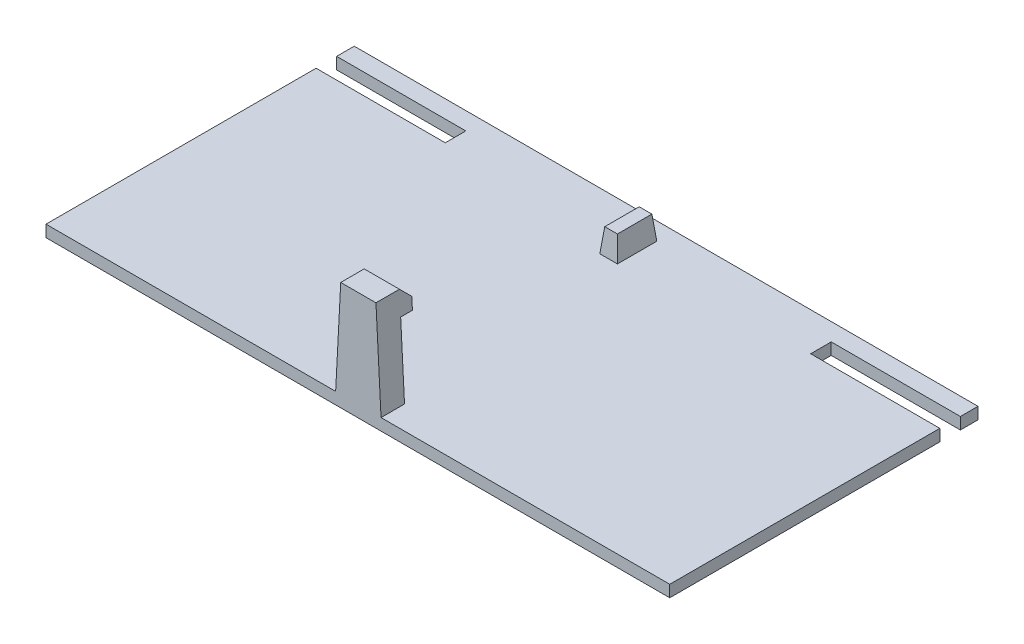
from build123d import *

# Parameters (mm, degrees)
SKETCH1_W             = 53.116817528
SKETCH1_H             = 26.25
BOSS_EXTRUDE1_DEPTH   = 1
SKETCH2_W             = 1.5
SKETCH2_H             = 3.354457941
BOSS_EXTRUDE2_DEPTH   = 2
BOSS_EXTRUDE2_TAPER   = 6
SNAP_START            = 10.433767634
SNAP_HOOK3_DEPTH      = 2
SNAP_HOOK3_2_DEPTH    = 2
SKETCH5_W             = 0.807692308
SKETCH5_H             = 3.288461538
SKETCH5_H_2           = 4.615384615
LETTERING_DEPTH       = 0.25
SOLAR_ARM_HOLES_REACH = 216.666
SKETCH6_W             = 11
SKETCH6_H             = 1.75


with BuildPart() as part:
    # Sketch1 → Boss-Extrude1 (new body)
    with BuildSketch(Plane(origin=(0, 0, 0), x_dir=(1, 0, 0), z_dir=(0, 1, 0))):
        with Locations((187.462852022, 0.691232366)):
            Rectangle(SKETCH1_W, SKETCH1_H)
    extrude(amount=BOSS_EXTRUDE1_DEPTH)

    # Sketch2 → Boss-Extrude2 (add)
    with BuildSketch(Plane(origin=(0, 1, 0), x_dir=(1, 0, 0), z_dir=(0, 1, 0))):
        with Locations((187.420846341, 10.639003396)):
            Rectangle(SKETCH2_W, SKETCH2_H)
    extrude(amount=BOSS_EXTRUDE2_DEPTH, taper=BOSS_EXTRUDE2_TAPER)



with BuildPart() as body_2:
    # Snap Hook3: read off the stored shape, not the designer's step
    # Snap Hook3 outline → Snap Hook3 (new body)
    with BuildSketch(Plane.XY.offset(SNAP_START)):
        Polygon((185.897673338, 7.25), (189.107304455, 7.25), (189.002488896, 9.25), (186.002488896, 9.25), align=None)
    extrude(amount=SNAP_HOOK3_DEPTH)


with BuildPart() as part_1:
    add(part.part)

    add(body_2.part)  # Snap Hook3 2 merges body 2
    # Snap Hook3 2 outline → Snap Hook3 2 (add)
    with BuildSketch(Plane.XY.offset(SNAP_START)):
        Polygon((185.570124717, 1), (189.434853075, 1), (189.107304455, 7.25), (185.897673338, 7.25), align=None)
    extrude(amount=SNAP_HOOK3_2_DEPTH)

    # Snap Hook3 3: loft between two sections, ruled curve by curve
    snap_hook3_3_from = [
        Edge.make_line((186.002488896, 9.25, 10.433767634), (189.002488896, 9.25, 10.433767634)),
        Edge.make_line((189.107304455, 7.25, 10.433767634), (185.897673338, 7.25, 10.433767634)),
        Edge.make_line((185.897673338, 7.25, 10.433767634), (186.002488896, 9.25, 10.433767634)),
        Edge.make_line((189.107304455, 7.25, 10.433767634), (189.002488896, 9.25, 10.433767634)),
    ]
    snap_hook3_3_to = [
        Edge.make_line((185.950081117, 8.25, 9.433767634), (189.054896676, 8.25, 9.433767634)),
        Edge.make_line((189.107304455, 7.25, 9.433767634), (185.897673338, 7.25, 9.433767634)),
        Edge.make_line((185.897673338, 7.25, 9.433767634), (185.950081117, 8.25, 9.433767634)),
        Edge.make_line((189.107304455, 7.25, 9.433767634), (189.054896676, 8.25, 9.433767634)),
    ]
    snap_hook3_3 = Solid(Shell([*[Face.make_surface_from_curves(snap_hook3_3_from[k], snap_hook3_3_to[k]) for k in range(4)], Face(Wire(snap_hook3_3_from)), Face(Wire(snap_hook3_3_to))]))
    add(snap_hook3_3)

    # Sketch5 → Lettering (cut)
    # profile 1 of 14: a face of its own
    with BuildSketch(Plane.XZ):
        with BuildLine():
            Line((168.666698176, 3.207505615), (168.06273183, 2.65492148))
            add(Edge.make_bspline(
                [(168.06273183, 2.65492148), (168.036860501, 2.691415678), (167.987191158, 2.76147945), (167.906682334, 2.855296492), (167.826537048, 2.935329411), (167.746012804, 3.001243865), (167.664395865, 3.052639376), (167.581827906, 3.089027966), (167.498777028, 3.112160538), (167.442979658, 3.1150411), (167.415496253, 3.116459942)],
                knots=[0, 0, 0, 0, 1.299362458, 2.494594718, 3.587462134, 4.587049575, 5.512617175, 6.380583204, 7.202344345, 8, 8, 8, 8], degree=3))
            add(Edge.make_bspline(
                [(167.415496253, 3.116459942), (167.389860521, 3.115560898), (167.340364658, 3.113825082), (167.269804633, 3.096571196), (167.207160438, 3.066793523), (167.152493211, 3.02785671), (167.109188702, 2.980946878), (167.07461341, 2.931750526), (167.055144615, 2.877448879), (167.052582138, 2.840152317), (167.05131356, 2.821688307)],
                knots=[0, 0, 0, 0, 1.185010067, 2.2879431, 3.333075148, 4.379039566, 5.372662701, 6.27520591, 7.14612461, 8, 8, 8, 8], degree=3))
            add(Edge.make_bspline(
                [(167.05131356, 2.821688307), (167.052108514, 2.802958037), (167.053709439, 2.765237877), (167.069172203, 2.709954284), (167.092479003, 2.655935779), (167.114749602, 2.623052144), (167.126133272, 2.606243595)],
                knots=[0, 0, 0, 0, 0.967525499, 1.948461899, 2.951351359, 4, 4, 4, 4], degree=3))
            add(Edge.make_bspline(
                [(167.126133272, 2.606243595), (167.136482259, 2.593178486), (167.160304262, 2.56310433), (167.205727943, 2.515471555), (167.262770545, 2.457117235), (167.33362719, 2.390048007), (167.415356422, 2.311851796), (167.511746498, 2.225602527), (167.620022889, 2.128629159), (167.69698324, 2.061100417), (167.737311156, 2.025714749)],
                knots=[0, 0, 0, 0, 0.473873513, 1.090794244, 1.870441696, 2.795289791, 3.865433203, 5.087734844, 6.473946851, 8, 8, 8, 8], degree=3))
            add(Edge.make_bspline(
                [(167.737311156, 2.025714749), (167.775164707, 1.99295441), (167.847002882, 1.930782094), (167.949214339, 1.842538473), (168.039041186, 1.763147838), (168.117791996, 1.693801675), (168.184272984, 1.633772381), (168.238763635, 1.582773019), (168.28192946, 1.541796451), (168.306466705, 1.517046579), (168.31693856, 1.50648398)],
                knots=[0, 0, 0, 0, 1.543621617, 2.929473131, 4.163658386, 5.240097082, 6.164993805, 6.925417477, 7.541396219, 8, 8, 8, 8], degree=3))
            add(Edge.make_bspline(
                [(168.31693856, 1.50648398), (168.356666597, 1.463489735), (168.433037837, 1.380839698), (168.532293525, 1.252758133), (168.613984168, 1.127724409), (168.677181597, 1.003385815), (168.724910838, 0.87794839), (168.758560585, 0.74833579), (168.778713643, 0.613193644), (168.780951103, 0.520975627), (168.782082791, 0.474332538)],
                knots=[0, 0, 0, 0, 1.206664779, 2.319633467, 3.337109185, 4.282041471, 5.190008762, 6.099243693, 7.03861361, 8, 8, 8, 8], degree=3))
            add(Edge.make_bspline(
                [(168.782082791, 0.474332538), (168.781277284, 0.428884567), (168.77969685, 0.339713958), (168.760339563, 0.209226053), (168.732737208, 0.084343466), (168.690059125, -0.033574907), (168.63804333, -0.146464657), (168.572834018, -0.252567322), (168.496254623, -0.352956705), (168.408482878, -0.445838223), (168.311396905, -0.530121762), (168.207262973, -0.605152959), (168.095062807, -0.667100769), (167.975755027, -0.718110373), (167.849403497, -0.757398651), (167.716158739, -0.786436351), (167.575816946, -0.80386432), (167.479849205, -0.805686207), (167.430820772, -0.806616982)],
                knots=[0, 0, 0, 0, 1.043214005, 2.046824704, 3.02475056, 3.976699089, 4.921714032, 5.875962561, 6.831408892, 7.817874052, 8.806269674, 9.781291748, 10.760897367, 11.74438705, 12.757449933, 13.795994037, 14.874007457, 16, 16, 16, 16], degree=3))
            add(Edge.make_bspline(
                [(167.430820772, -0.806616982), (167.392333869, -0.805934198), (167.316107729, -0.804581896), (167.203761923, -0.793541471), (167.095279347, -0.775723401), (166.990782197, -0.750184784), (166.889799696, -0.717823892), (166.792327695, -0.678296302), (166.699039077, -0.630989352), (166.609227976, -0.576875859), (166.523330984, -0.514042967), (166.440261968, -0.443775272), (166.360846047, -0.364992026), (166.284701805, -0.277879549), (166.212316431, -0.182191158), (166.141320495, -0.079259492), (166.074869268, 0.032825721), (166.033819389, 0.111454405), (166.012852022, 0.151616192)],
                knots=[0, 0, 0, 0, 1.016823716, 2.013894106, 2.979844003, 3.91962641, 4.853723003, 5.779685073, 6.695824784, 7.614987388, 8.547259901, 9.504950863, 10.487499108, 11.500346958, 12.559593716, 13.656357062, 14.802919212, 16, 16, 16, 16], degree=3))
            Line((166.012852022, 0.151616192), (166.72318856, 0.577998403))
            add(Edge.make_bspline(
                [(166.72318856, 0.577998403), (166.749415603, 0.532409528), (166.799695084, 0.445011759), (166.884898366, 0.327581779), (166.972184778, 0.227022439), (167.063572305, 0.145111132), (167.157949708, 0.080752599), (167.255772852, 0.034757527), (167.357110466, 0.006286629), (167.426137044, 0.002809675), (167.460568368, 0.001075326)],
                knots=[0, 0, 0, 0, 1.283663364, 2.460892379, 3.537111102, 4.529833553, 5.449777664, 6.316464042, 7.160231139, 8, 8, 8, 8], degree=3))
            add(Edge.make_bspline(
                [(167.460568368, 0.001075326), (167.495589953, 0.002491689), (167.56353693, 0.005239639), (167.660522544, 0.030621629), (167.749442627, 0.070473214), (167.82630449, 0.12733593), (167.89138627, 0.192964147), (167.939420359, 0.26597854), (167.969595698, 0.34497835), (167.972785963, 0.399856815), (167.974390483, 0.427457538)],
                knots=[0, 0, 0, 0, 1.13588714, 2.203786484, 3.234766741, 4.283437687, 5.291419208, 6.222934724, 7.106237994, 8, 8, 8, 8], degree=3))
            add(Edge.make_bspline(
                [(167.974390483, 0.427457538), (167.972908774, 0.453135519), (167.969898825, 0.50529788), (167.947728461, 0.582854923), (167.913069421, 0.660376694), (167.872065333, 0.723962149), (167.830338539, 0.777200526), (167.790438312, 0.823329172), (167.74185039, 0.87429325), (167.684697972, 0.930156868), (167.619736189, 0.99141181), (167.54691032, 1.058052076), (167.465386431, 1.129490645), (167.407765185, 1.178153893), (167.377635676, 1.203599365)],
                knots=[0, 0, 0, 0, 0.916159276, 1.861089862, 2.860218735, 3.940849679, 4.552606315, 5.27541173, 6.11797699, 7.06649574, 8.129236253, 9.306560635, 10.591630461, 12, 12, 12, 12], degree=3))
            add(Edge.make_bspline(
                [(167.377635676, 1.203599365), (167.320358279, 1.252061535), (167.210425618, 1.345075108), (167.05507682, 1.482453227), (166.915093644, 1.610845667), (166.791685134, 1.731839639), (166.683278875, 1.843200666), (166.590609041, 1.945833263), (166.514693653, 2.040529101), (166.434809076, 2.152689985), (166.358902756, 2.289365728), (166.293298155, 2.453802491), (166.250736659, 2.61821839), (166.245968236, 2.728598169), (166.243621253, 2.782926288)],
                knots=[0, 0, 0, 0, 1.345494975, 2.582412109, 3.71882943, 4.751509156, 5.681369928, 6.505683931, 7.230279997, 7.856715994, 8.973648664, 10.023341002, 11.027102913, 12, 12, 12, 12], degree=3))
            add(Edge.make_bspline(
                [(166.243621253, 2.782926288), (166.24459736, 2.821452874), (166.246520396, 2.897354386), (166.263674174, 3.008956502), (166.289311149, 3.116643166), (166.326543396, 3.220021489), (166.374866358, 3.318961985), (166.433552717, 3.413949009), (166.503513764, 3.504108324), (166.582355139, 3.589380158), (166.66921815, 3.667308911), (166.762042315, 3.736088844), (166.860302243, 3.794181375), (166.963396828, 3.842373348), (167.071964904, 3.879261242), (167.185206656, 3.90540922), (167.303284509, 3.920961204), (167.383598515, 3.923075315), (167.424510676, 3.924152249)],
                knots=[0, 0, 0, 0, 1.010766082, 1.991317756, 2.957454644, 3.913069143, 4.869106762, 5.843196583, 6.838735724, 7.860187025, 8.887984031, 9.89767229, 10.887916223, 11.879572884, 12.879850636, 13.892031539, 14.926195476, 16, 16, 16, 16], degree=3))
            add(Edge.make_bspline(
                [(167.424510676, 3.924152249), (167.47753081, 3.92221266), (167.583152558, 3.918348791), (167.739317357, 3.888134602), (167.891852604, 3.840619606), (168.014768365, 3.783297992), (168.112570141, 3.727770517), (168.187526067, 3.676647812), (168.263797756, 3.618084007), (168.342000292, 3.55189455), (168.420680551, 3.476832346), (168.50207579, 3.394684309), (168.585076897, 3.304740489), (168.639014457, 3.240485041), (168.666698176, 3.207505615)],
                knots=[0, 0, 0, 0, 1.282922637, 2.555718331, 3.837320111, 5.142675274, 5.830281639, 6.55870424, 7.337177975, 8.157850921, 9.037902056, 9.96903443, 10.957596896, 12, 12, 12, 12], degree=3))
        make_face()
    # profile 2 of 14: a face of its own
    with BuildSketch(Plane.XZ):
        with BuildLine():
            Line((170.997467406, 2.597229172), (171.805159714, 2.597229172))
            Line((171.805159714, 2.597229172), (171.805159714, 2.204200326))
            add(Edge.make_bspline(
                [(171.805159714, 2.204200326), (171.841085458, 2.240459725), (171.911820294, 2.311851502), (172.029041754, 2.403632049), (172.151315607, 2.482115756), (172.280123618, 2.545653257), (172.415150727, 2.594168727), (172.555756977, 2.629720148), (172.702664579, 2.650694373), (172.802688801, 2.653496825), (172.853537118, 2.65492148)],
                knots=[0, 0, 0, 0, 1.041528618, 2.050684245, 3.032913108, 4.004406485, 4.976926473, 5.95771665, 6.961784757, 8, 8, 8, 8], degree=3))
            add(Edge.make_bspline(
                [(172.853537118, 2.65492148), (172.904452573, 2.653319962), (173.004677999, 2.650167426), (173.150906198, 2.621318768), (173.289434053, 2.574449446), (173.418737433, 2.507642986), (173.539750866, 2.425140481), (173.647113378, 2.322679591), (173.743752541, 2.204339063), (173.795264935, 2.114872351), (173.821686156, 2.06898398)],
                knots=[0, 0, 0, 0, 1.023965777, 2.015643508, 2.987309376, 3.958410333, 4.93654923, 5.924956801, 6.93568961, 8, 8, 8, 8], degree=3))
            add(Edge.make_bspline(
                [(173.821686156, 2.06898398), (173.855720104, 2.114997184), (173.922519192, 2.205308192), (174.040926661, 2.323219453), (174.168960461, 2.425151165), (174.309097753, 2.508252078), (174.457616975, 2.574221413), (174.613868226, 2.621144622), (174.77643488, 2.650119212), (174.887070409, 2.653307426), (174.943080387, 2.65492148)],
                knots=[0, 0, 0, 0, 1.041189987, 2.043563759, 3.033412161, 4.015238574, 5.00275396, 5.986226558, 6.980513695, 8, 8, 8, 8], degree=3))
            add(Edge.make_bspline(
                [(174.943080387, 2.65492148), (175.000932044, 2.653245533), (175.113592766, 2.649981783), (175.276854332, 2.617872194), (175.429768544, 2.568258061), (175.568956042, 2.496057355), (175.694813802, 2.410532759), (175.802059796, 2.309481881), (175.891064171, 2.196430816), (175.949017434, 2.090868705), (175.986482661, 1.997539711), (176.009104497, 1.916326), (176.030262914, 1.825640619), (176.045463119, 1.72426463), (176.05965184, 1.613150888), (176.06788895, 1.491560673), (176.073487799, 1.359903592), (176.074082468, 1.268810775), (176.074390483, 1.221628211)],
                knots=[0, 0, 0, 0, 1.321991808, 2.574456155, 3.791773975, 4.987670122, 6.148905103, 7.262530793, 8.344737981, 9.427709016, 10.004683293, 10.642050061, 11.354108788, 12.133887687, 12.985666279, 13.916212488, 14.92067847, 16, 16, 16, 16], degree=3))
            Line((176.074390483, 1.221628211), (176.074390483, -0.691232366))
            Line((176.074390483, -0.691232366), (175.266698176, -0.691232366))
            Line((175.266698176, -0.691232366), (175.266698176, 0.960209942))
            add(Edge.make_bspline(
                [(175.266698176, 0.960209942), (175.266025925, 1.004382953), (175.2647356, 1.089169058), (175.259249932, 1.210778539), (175.246970661, 1.321067843), (175.232577782, 1.42064787), (175.211981294, 1.508990637), (175.186867617, 1.586309104), (175.157735905, 1.652714568), (175.122560239, 1.708200108), (175.083163453, 1.754927698), (175.039340212, 1.794982496), (174.99154744, 1.829157165), (174.939351825, 1.858286213), (174.881385977, 1.877986765), (174.81960673, 1.893444521), (174.753530644, 1.903971364), (174.707845653, 1.904598944), (174.684366445, 1.90492148)],
                knots=[0, 0, 0, 0, 1.669139205, 3.203761885, 4.596586177, 5.860166715, 7.002923539, 8.018877315, 8.928339525, 9.734594377, 10.491888885, 11.231098709, 11.971440889, 12.708030942, 13.480072485, 14.275788656, 15.113863979, 16, 16, 16, 16], degree=3))
            add(Edge.make_bspline(
                [(174.684366445, 1.90492148), (174.648185318, 1.903670605), (174.577187057, 1.901216011), (174.47372812, 1.877759617), (174.376372499, 1.839410925), (174.285484926, 1.787240925), (174.203021101, 1.722081581), (174.130886129, 1.644796386), (174.071312702, 1.554939939), (174.030074524, 1.47157118), (174.004305843, 1.39618907), (173.98612838, 1.331630347), (173.97195977, 1.25862398), (173.960869898, 1.177909355), (173.950230459, 1.089030185), (173.945010811, 0.992098859), (173.939669517, 0.887250039), (173.93973905, 0.814786016), (173.939775099, 0.777217153)],
                knots=[0, 0, 0, 0, 1.129913425, 2.217230253, 3.297175357, 4.391411011, 5.481605898, 6.571841268, 7.681894157, 8.841607612, 9.468549532, 10.170608623, 10.93710061, 11.791434153, 12.717934886, 13.734733707, 14.825576123, 16, 16, 16, 16], degree=3))
            Line((173.939775099, 0.777217153), (173.939775099, -0.691232366))
            Line((173.939775099, -0.691232366), (173.132082791, -0.691232366))
            Line((173.132082791, -0.691232366), (173.132082791, 0.88539023))
            add(Edge.make_bspline(
                [(173.132082791, 0.88539023), (173.132014977, 0.92055099), (173.131884525, 0.988188902), (173.127963388, 1.085859342), (173.122771038, 1.1760446), (173.115491967, 1.258996217), (173.107096992, 1.334611022), (173.094981109, 1.402475351), (173.082252256, 1.462963155), (173.060428465, 1.531675496), (173.029675937, 1.607820269), (172.983731211, 1.688567561), (172.928177762, 1.756174388), (172.864419701, 1.811166875), (172.792370355, 1.853066738), (172.71385496, 1.884235029), (172.627374313, 1.901058715), (172.567846818, 1.90360672), (172.537130868, 1.90492148)],
                knots=[0, 0, 0, 0, 1.256487322, 2.417074606, 3.49288742, 4.484586665, 5.393016842, 6.210437544, 6.947749329, 7.599905853, 8.784490193, 9.876739139, 10.906602197, 11.896672079, 12.869113195, 13.872201355, 14.902064413, 16, 16, 16, 16], degree=3))
            add(Edge.make_bspline(
                [(172.537130868, 1.90492148), (172.502424488, 1.903743485), (172.433688212, 1.901410457), (172.333563326, 1.876351825), (172.237834649, 1.838706759), (172.148608116, 1.785081659), (172.067386613, 1.718388917), (171.995973866, 1.63890541), (171.93671352, 1.546725418), (171.895292294, 1.46105705), (171.86989935, 1.383794261), (171.851233122, 1.31755921), (171.837591675, 1.242945078), (171.826209994, 1.160789651), (171.815633545, 1.070995953), (171.810392299, 0.973169106), (171.805056284, 0.867417543), (171.805124406, 0.794353152), (171.805159714, 0.75648398)],
                knots=[0, 0, 0, 0, 1.07893236, 2.136834559, 3.195274846, 4.273923004, 5.364443877, 6.458052972, 7.587287137, 8.767908, 9.410170275, 10.118584836, 10.909717261, 11.770069756, 12.702352573, 13.724628867, 14.820678298, 16, 16, 16, 16], degree=3))
            Line((171.805159714, 0.75648398), (171.805159714, -0.691232366))
            Line((171.805159714, -0.691232366), (170.997467406, -0.691232366))
            Line((170.997467406, -0.691232366), (170.997467406, 2.597229172))
        make_face()
    # profile 3 of 14: a face of its own
    with BuildSketch(Plane.XZ):
        with BuildLine():
            Line((180.885928945, 2.597229172), (181.693621253, 2.597229172))
            Line((181.693621253, 2.597229172), (181.693621253, -0.691232366))
            Line((181.693621253, -0.691232366), (180.885928945, -0.691232366))
            Line((180.885928945, -0.691232366), (180.885928945, -0.332458328))
            add(Edge.make_bspline(
                [(180.885928945, -0.332458328), (180.845908089, -0.36738101), (180.76823551, -0.435159038), (180.645848659, -0.523102754), (180.52310418, -0.595644954), (180.399412282, -0.65342086), (180.272871872, -0.69608242), (180.14257191, -0.726970386), (180.006635938, -0.745185775), (179.914228537, -0.747665392), (179.867299137, -0.748924674)],
                knots=[0, 0, 0, 0, 1.129196829, 2.191548051, 3.199897424, 4.157751732, 5.089409408, 6.034969131, 7.002052659, 8, 8, 8, 8], degree=3))
            add(Edge.make_bspline(
                [(179.867299137, -0.748924674), (179.814618799, -0.747739531), (179.710519466, -0.745397622), (179.557765251, -0.720745247), (179.410265871, -0.683009292), (179.268141053, -0.629608199), (179.13164938, -0.560410852), (178.999746278, -0.477222706), (178.874692968, -0.37712336), (178.755448423, -0.264443857), (178.646268833, -0.140495601), (178.550823005, -0.006998979), (178.470369266, 0.134152656), (178.404457822, 0.282491321), (178.35260996, 0.437908143), (178.315649853, 0.600896057), (178.293843348, 0.771513275), (178.291144317, 0.887731043), (178.289775099, 0.946688307)],
                knots=[0, 0, 0, 0, 0.980476535, 1.937477201, 2.874147792, 3.812856188, 4.758993464, 5.720109578, 6.712210464, 7.737600662, 8.772720504, 9.783789959, 10.789002326, 11.793715968, 12.802552247, 13.835794126, 14.902098527, 16, 16, 16, 16], degree=3))
            add(Edge.make_bspline(
                [(178.289775099, 0.946688307), (178.291212098, 1.007738632), (178.294030933, 1.127495646), (178.314650541, 1.30323337), (178.350928595, 1.470262557), (178.400396329, 1.628814565), (178.464027979, 1.778916786), (178.541527077, 1.920815137), (178.633947925, 2.054138716), (178.740446569, 2.176618264), (178.855438948, 2.288876685), (178.978460464, 2.386606543), (179.10758733, 2.469632605), (179.242956766, 2.537414091), (179.38454944, 2.589792194), (179.531806348, 2.628084863), (179.685381206, 2.65106181), (179.789997643, 2.653624239), (179.842960195, 2.65492148)],
                knots=[0, 0, 0, 0, 1.136281865, 2.228943489, 3.287578264, 4.313574083, 5.316051562, 6.317280042, 7.318008486, 8.329309503, 9.333984563, 10.305318864, 11.248632312, 12.186624717, 13.117503092, 14.05354244, 15.014596925, 16, 16, 16, 16], degree=3))
            add(Edge.make_bspline(
                [(179.842960195, 2.65492148), (179.892020679, 2.653902238), (179.989093692, 2.651885526), (180.131777036, 2.629987891), (180.2701593, 2.596869274), (180.403485603, 2.549681205), (180.53284953, 2.490096668), (180.656025942, 2.415432803), (180.775709432, 2.328827697), (180.848735179, 2.261187275), (180.885928945, 2.226736384)],
                knots=[0, 0, 0, 0, 1.017011718, 2.012299608, 2.98747302, 3.965332399, 4.941441765, 5.936729654, 6.94912688, 8, 8, 8, 8], degree=3))
            Line((180.885928945, 2.226736384), (180.885928945, 2.597229172))
        make_face()
        with BuildLine():
            add(Edge.make_bspline(
                [(180.012431349, 1.90492148), (179.980247191, 1.903933959), (179.917168344, 1.901998482), (179.824402266, 1.890356454), (179.735745725, 1.869842683), (179.651831011, 1.83953799), (179.571407488, 1.802622459), (179.495696398, 1.756386364), (179.424072875, 1.701736282), (179.356958145, 1.639995291), (179.29577318, 1.572130654), (179.243028169, 1.498075631), (179.198203431, 1.419825584), (179.160293353, 1.337145242), (179.133158338, 1.249056242), (179.111667417, 1.156705345), (179.10051502, 1.059338091), (179.098493442, 0.992985322), (179.097467406, 0.959308499)],
                knots=[0, 0, 0, 0, 1.04836806, 2.054732945, 3.03993516, 4.00574415, 4.955904794, 5.917688631, 6.888591924, 7.88601754, 8.884115178, 9.859153345, 10.841239365, 11.818093293, 12.814750328, 13.83810466, 14.90274714, 16, 16, 16, 16], degree=3))
            add(Edge.make_bspline(
                [(179.097467406, 0.959308499), (179.098477769, 0.925326208), (179.100468678, 0.858364498), (179.11184774, 0.760175917), (179.132565329, 0.66647599), (179.16279151, 0.578022218), (179.199704688, 0.493621066), (179.244636326, 0.413662054), (179.299826975, 0.339558956), (179.361065575, 0.269558246), (179.429557153, 0.207050328), (179.501585951, 0.151549036), (179.578135824, 0.105111141), (179.658376261, 0.06757974), (179.74203717, 0.036994803), (179.830167403, 0.016738847), (179.921903614, 0.003789598), (179.984442612, 0.001986331), (180.016037118, 0.001075326)],
                knots=[0, 0, 0, 0, 1.099136573, 2.165835871, 3.191374663, 4.196217796, 5.183857741, 6.167377911, 7.154730987, 8.166690795, 9.170734848, 10.148332609, 11.103258353, 12.059567475, 13.009337315, 13.978056681, 14.978520572, 16, 16, 16, 16], degree=3))
            add(Edge.make_bspline(
                [(180.016037118, 0.001075326), (180.048820743, 0.002068383), (180.11309447, 0.004015316), (180.207373979, 0.015551097), (180.297221496, 0.036140085), (180.382263206, 0.066618279), (180.463798041, 0.103268829), (180.541090223, 0.148601436), (180.613301015, 0.20312611), (180.68079613, 0.265425242), (180.742642392, 0.333844035), (180.796116825, 0.408870172), (180.842695012, 0.488104111), (180.879326613, 0.573419233), (180.908417242, 0.663322919), (180.929289097, 0.758373133), (180.940642175, 0.858672348), (180.942615672, 0.927130471), (180.943621253, 0.962012826)],
                knots=[0, 0, 0, 0, 1.050008698, 2.058587853, 3.036635738, 3.995319155, 4.947022481, 5.895997462, 6.858296291, 7.838991643, 8.833936038, 9.806048392, 10.784806122, 11.771666913, 12.772873988, 13.80724452, 14.882696879, 16, 16, 16, 16], degree=3))
            add(Edge.make_bspline(
                [(180.943621253, 0.962012826), (180.942628167, 0.996295221), (180.940688382, 1.063258697), (180.929240134, 1.161463712), (180.908220101, 1.254647573), (180.879728205, 1.342981564), (180.842444917, 1.42626371), (180.795831487, 1.503570611), (180.742943638, 1.577580662), (180.680412649, 1.644151084), (180.613283169, 1.705999122), (180.540010401, 1.758874931), (180.462902834, 1.80444477), (180.381486718, 1.841859366), (180.295008176, 1.869285683), (180.205007116, 1.890520877), (180.110079335, 1.901991495), (180.045511845, 1.90392888), (180.012431349, 1.90492148)],
                knots=[0, 0, 0, 0, 1.106611376, 2.161533483, 3.185006901, 4.184773755, 5.152708835, 6.122342771, 7.094156588, 8.082475533, 9.064254463, 10.03606828, 10.992420271, 11.951521816, 12.920622147, 13.915721683, 14.932141191, 16, 16, 16, 16], degree=3))
        make_face(mode=Mode.SUBTRACT)
    # profile 4 of 14: a face of its own
    with BuildSketch(Plane.XZ):
        with BuildLine():
            Line((183.909005868, 2.597229172), (184.60131356, 2.597229172))
            Line((184.60131356, 2.597229172), (184.60131356, 2.192481576))
            add(Edge.make_bspline(
                [(184.60131356, 2.192481576), (184.620897616, 2.228451606), (184.659175465, 2.298756523), (184.729495084, 2.39312695), (184.81028111, 2.472603091), (184.898630653, 2.538847262), (184.994811481, 2.590478088), (185.096248043, 2.627271561), (185.202072553, 2.65118222), (185.274262445, 2.653666085), (185.310748656, 2.65492148)],
                knots=[0, 0, 0, 0, 1.09866127, 2.147379032, 3.14564304, 4.131443017, 5.102343063, 6.064490016, 7.021754664, 8, 8, 8, 8], degree=3))
            add(Edge.make_bspline(
                [(185.310748656, 2.65492148), (185.337242198, 2.653680887), (185.39119251, 2.651154598), (185.473420377, 2.636469239), (185.556834648, 2.609915317), (185.611728426, 2.586007039), (185.639775099, 2.573791672)],
                knots=[0, 0, 0, 0, 0.931404136, 1.896671404, 2.925354185, 4, 4, 4, 4], degree=3))
            Line((185.639775099, 2.573791672), (185.389174137, 1.889596961))
            add(Edge.make_bspline(
                [(185.389174137, 1.889596961), (185.36677399, 1.900419629), (185.324670336, 1.920762079), (185.263543141, 1.944768265), (185.208067677, 1.959415667), (185.172897251, 1.961601188), (185.156602022, 1.962613788)],
                knots=[0, 0, 0, 0, 1.214386998, 2.282580073, 3.20428172, 4, 4, 4, 4], degree=3))
            add(Edge.make_bspline(
                [(185.156602022, 1.962613788), (185.141216157, 1.961942786), (185.110949509, 1.960622809), (185.066276785, 1.949311058), (185.024204381, 1.929804294), (184.98270483, 1.904814194), (184.945051988, 1.870076085), (184.907422403, 1.829860557), (184.874261198, 1.780209137), (184.83926651, 1.724944586), (184.809469784, 1.657300825), (184.783920009, 1.576548115), (184.761154954, 1.48175209), (184.745489489, 1.37240943), (184.730348187, 1.249578214), (184.721335713, 1.112356877), (184.714618601, 0.961179325), (184.714207895, 0.855651938), (184.713993849, 0.800654653)],
                knots=[0, 0, 0, 0, 0.544232178, 1.070598461, 1.618251235, 2.182094276, 2.777567932, 3.425210017, 4.127676488, 4.886675562, 5.738955394, 6.734782583, 7.883056018, 9.186093582, 10.642914445, 12.264202625, 14.053029461, 16, 16, 16, 16], degree=3))
            Line((184.713993849, 0.800654653), (184.716698176, 0.640197922))
            Line((184.716698176, 0.640197922), (184.716698176, -0.691232366))
            Line((184.716698176, -0.691232366), (183.909005868, -0.691232366))
            Line((183.909005868, -0.691232366), (183.909005868, 2.597229172))
        make_face()
    # profile 5 of 14: a face of its own
    with BuildSketch(Plane.XZ):
        Polygon((187.624390483, 3.924152249), (188.432082791, 3.924152249), (188.432082791, 2.597229172), (188.95131356, 2.597229172), (188.95131356, 1.90492148), (188.432082791, 1.90492148), (188.432082791, -0.691232366), (187.624390483, -0.691232366), (187.624390483, 1.90492148), (187.22054433, 1.90492148), (187.22054433, 2.597229172), (187.624390483, 2.597229172), align=None)
    # profile 6 of 14: a face of its own
    with BuildSketch(Plane.XZ):
        with BuildLine():
            add(Edge.make_bspline(
                [(191.280279906, 3.981844557), (191.315091439, 3.980136571), (191.383447238, 3.976782777), (191.481376221, 3.944090744), (191.571255181, 3.892781576), (191.650710674, 3.822384173), (191.716794323, 3.738316799), (191.767284686, 3.644197784), (191.795410763, 3.539916946), (191.799317059, 3.467880835), (191.80131356, 3.431063307)],
                knots=[0, 0, 0, 0, 0.989868614, 1.943702388, 2.910836514, 3.924849579, 4.949916355, 5.946401046, 6.950409252, 8, 8, 8, 8], degree=3))
            add(Edge.make_bspline(
                [(191.80131356, 3.431063307), (191.799388491, 3.394517104), (191.795637401, 3.323305088), (191.766637347, 3.220439911), (191.718173492, 3.12636661), (191.651554606, 3.043547792), (191.572960515, 2.974284181), (191.485045479, 2.922043526), (191.388054939, 2.891170143), (191.320759816, 2.88753599), (191.286590003, 2.885690711)],
                knots=[0, 0, 0, 0, 1.05296456, 2.051751585, 3.055639087, 4.085634717, 5.099016424, 6.062201612, 7.016062274, 8, 8, 8, 8], degree=3))
            add(Edge.make_bspline(
                [(191.286590003, 2.885690711), (191.251474594, 2.887392591), (191.182524103, 2.890734299), (191.0837919, 2.923502823), (190.992714185, 2.974407899), (190.913603369, 3.04624363), (190.846762914, 3.130908367), (190.798477991, 3.227218554), (190.768274577, 3.332212461), (190.764689458, 3.405315476), (190.762852022, 3.442782057)],
                knots=[0, 0, 0, 0, 0.989065327, 1.942068821, 2.907541208, 3.917690034, 4.939857478, 5.938239964, 6.943311734, 8, 8, 8, 8], degree=3))
            add(Edge.make_bspline(
                [(190.762852022, 3.442782057), (190.764851655, 3.478707683), (190.768779645, 3.54927839), (190.797074201, 3.651240759), (190.846406821, 3.743777486), (190.912014464, 3.826305929), (190.99077207, 3.895390155), (191.080597074, 3.94514103), (191.177866992, 3.976482789), (191.245789781, 3.980038847), (191.280279906, 3.981844557)],
                knots=[0, 0, 0, 0, 1.038616768, 2.040212704, 3.031499824, 4.052181184, 5.074969369, 6.039807101, 7.004644834, 8, 8, 8, 8], degree=3))
        make_face()
    # profile 7 of 14: a face of its own
    with BuildSketch(Plane.XZ):
        with Locations((191.282082791, 0.952998403)):
            Rectangle(SKETCH5_W, SKETCH5_H)
    # profile 8 of 14: a face of its own
    with BuildSketch(Plane.XZ):
        with BuildLine():
            Line((197.132082791, 1.926556095), (196.463212599, 1.558767634))
            add(Edge.make_bspline(
                [(196.463212599, 1.558767634), (196.432554027, 1.589469492), (196.373620544, 1.648486183), (196.279115968, 1.723191951), (196.186300064, 1.785046248), (196.091346418, 1.830691542), (195.993406256, 1.865066823), (195.888946995, 1.887834328), (195.776749413, 1.90282592), (195.699142217, 1.904208558), (195.65912606, 1.90492148)],
                knots=[0, 0, 0, 0, 1.150764855, 2.212059359, 3.192108068, 4.105322427, 5.000809612, 5.941206042, 6.938435785, 8, 8, 8, 8], degree=3))
            add(Edge.make_bspline(
                [(195.65912606, 1.90492148), (195.622428483, 1.904035098), (195.550614401, 1.902300523), (195.445682632, 1.889344436), (195.345955738, 1.868995365), (195.251612734, 1.839224602), (195.162821655, 1.799895804), (195.078848237, 1.753356087), (195.000508481, 1.697787673), (194.92890974, 1.633980453), (194.864279291, 1.563730117), (194.806625634, 1.488805116), (194.759393673, 1.408093953), (194.718558714, 1.323493635), (194.688536354, 1.233415177), (194.666571265, 1.138675948), (194.654051369, 1.039271751), (194.652237457, 0.971361702), (194.65131356, 0.936772442)],
                knots=[0, 0, 0, 0, 1.121765476, 2.195200973, 3.227634963, 4.230038321, 5.213228299, 6.192116585, 7.160777141, 8.14345191, 9.118668839, 10.075979138, 11.027630062, 11.972829041, 12.943187208, 13.923755399, 14.94248691, 16, 16, 16, 16], degree=3))
            add(Edge.make_bspline(
                [(194.65131356, 0.936772442), (194.652289737, 0.903085847), (194.65419579, 0.837310384), (194.665905942, 0.740670554), (194.686235205, 0.64867356), (194.716716274, 0.561805763), (194.753251244, 0.479266365), (194.799132477, 0.401711818), (194.853086279, 0.328803462), (194.915396696, 0.261174975), (194.984420826, 0.200351449), (195.05883425, 0.146637978), (195.138414949, 0.101098892), (195.224089959, 0.065360944), (195.314462435, 0.036241993), (195.410135888, 0.01550816), (195.511008505, 0.003999448), (195.579770815, 0.002065101), (195.614955387, 0.001075326)],
                knots=[0, 0, 0, 0, 1.070556293, 2.090336998, 3.088792742, 4.058148387, 5.011235098, 5.952916408, 6.915475435, 7.888633318, 8.869583867, 9.83422472, 10.800707077, 11.776204622, 12.778807041, 13.814557445, 14.881744048, 16, 16, 16, 16], degree=3))
            add(Edge.make_bspline(
                [(195.614955387, 0.001075326), (195.658276029, 0.002066629), (195.742831626, 0.004001508), (195.865750926, 0.020412533), (195.981416304, 0.047550596), (196.089840029, 0.085111832), (196.190870412, 0.134223847), (196.284247863, 0.19421051), (196.370932301, 0.264629307), (196.421481889, 0.319529387), (196.446986637, 0.347229172)],
                knots=[0, 0, 0, 0, 1.116373375, 2.178998604, 3.189797796, 4.174590301, 5.13072713, 6.078291395, 7.030403691, 8, 8, 8, 8], degree=3))
            Line((196.446986637, 0.347229172), (197.074390483, -0.083660251))
            add(Edge.make_bspline(
                [(197.074390483, -0.083660251), (197.030901862, -0.13683059), (196.945080375, -0.24175821), (196.795345679, -0.377006081), (196.63418592, -0.493214056), (196.458359827, -0.585969788), (196.270428008, -0.659745115), (196.068921959, -0.711896947), (195.854182511, -0.742596509), (195.706703236, -0.746781569), (195.631181349, -0.748924674)],
                knots=[0, 0, 0, 0, 0.997876357, 1.969233105, 2.924898516, 3.881013542, 4.852507933, 5.855329832, 6.901747111, 8, 8, 8, 8], degree=3))
            add(Edge.make_bspline(
                [(195.631181349, -0.748924674), (195.563206966, -0.747353308), (195.430445502, -0.744284257), (195.236948966, -0.720781116), (195.054955427, -0.681193274), (194.884090495, -0.626213898), (194.72450995, -0.554995019), (194.576731326, -0.466656998), (194.439757858, -0.363657078), (194.316061099, -0.245508692), (194.205695207, -0.116902897), (194.109345386, 0.018539453), (194.026017653, 0.158391625), (193.960647128, 0.304981405), (193.907221392, 0.456023942), (193.871139327, 0.613324735), (193.847340983, 0.775588077), (193.844871142, 0.885604593), (193.843621253, 0.941279653)],
                knots=[0, 0, 0, 0, 1.183377041, 2.311265848, 3.387807024, 4.421911742, 5.431260577, 6.423665966, 7.413571885, 8.409103097, 9.395976332, 10.359992013, 11.300391101, 12.225292883, 13.150239058, 14.085544813, 15.031169026, 16, 16, 16, 16], degree=3))
            add(Edge.make_bspline(
                [(193.843621253, 0.941279653), (193.844290828, 0.98006894), (193.84561705, 1.05689859), (193.856938795, 1.170999189), (193.874551625, 1.283163546), (193.90102163, 1.392604327), (193.933575063, 1.499852498), (193.973148169, 1.604886501), (194.021301858, 1.707164342), (194.075017443, 1.807556059), (194.13623825, 1.903411457), (194.203028882, 1.994688232), (194.275295235, 2.080827354), (194.353886256, 2.161026032), (194.438253959, 2.235858118), (194.527171857, 2.306841817), (194.623517288, 2.370316336), (194.723940915, 2.429994108), (194.829307782, 2.483118819), (194.938406842, 2.528972449), (195.050395003, 2.567931721), (195.165540694, 2.599255762), (195.283349688, 2.625072514), (195.404870275, 2.641456886), (195.529097078, 2.65297311), (195.613125155, 2.654268108), (195.655520291, 2.65492148)],
                knots=[0, 0, 0, 0, 1.00272354, 1.986087015, 2.96193297, 3.936200312, 4.894695956, 5.858592327, 6.835334787, 7.815655071, 8.800643866, 9.773423113, 10.738352213, 11.705312252, 12.673769326, 13.65298065, 14.64420052, 15.654211674, 16.672258995, 17.692438602, 18.712115155, 19.735602823, 20.776372304, 21.827874031, 22.90408564, 24, 24, 24, 24], degree=3))
            add(Edge.make_bspline(
                [(195.655520291, 2.65492148), (195.694899933, 2.65447626), (195.772564915, 2.653598191), (195.887258537, 2.644416762), (195.99882355, 2.628821702), (196.107449817, 2.608190095), (196.213467234, 2.582623941), (196.315454887, 2.548545113), (196.414807119, 2.509866927), (196.542773844, 2.451466905), (196.69362319, 2.36429542), (196.859215358, 2.239272293), (197.006860822, 2.09301347), (197.090120278, 1.9823368), (197.132082791, 1.926556095)],
                knots=[0, 0, 0, 0, 0.826738014, 1.630502179, 2.413926014, 3.191023582, 3.95155221, 4.701751672, 5.446919844, 6.189438973, 7.653650558, 9.094719814, 10.535747635, 12, 12, 12, 12], degree=3))
        make_face()
    # profile 9 of 14: a face of its own
    with BuildSketch(Plane.XZ):
        with Locations((199.809005868, 1.616459942)):
            Rectangle(SKETCH5_W, SKETCH5_H_2)
    # profile 10 of 14: a face of its own
    with BuildSketch(Plane.XZ):
        with BuildLine():
            Line((205.771686156, 0.751075326), (203.178236637, 0.751075326))
            add(Edge.make_bspline(
                [(203.178236637, 0.751075326), (203.183524471, 0.720940914), (203.193915483, 0.661724417), (203.216479933, 0.575707316), (203.245275556, 0.494646252), (203.279785297, 0.418432867), (203.319427321, 0.346664249), (203.365666458, 0.279677022), (203.417916207, 0.217530353), (203.475874473, 0.160494338), (203.538575198, 0.109388833), (203.605714305, 0.06461718), (203.677361079, 0.027907163), (203.752694115, -0.003035572), (203.832276326, -0.027545353), (203.916224836, -0.044449283), (204.004317111, -0.054434496), (204.064328259, -0.055878743), (204.095003464, -0.056616982)],
                knots=[0, 0, 0, 0, 1.091296461, 2.144483647, 3.168565212, 4.157007626, 5.126487748, 6.090021542, 7.05641414, 8.019231907, 8.98705074, 9.938580405, 10.892824166, 11.854447369, 12.841318655, 13.858982407, 14.905600794, 16, 16, 16, 16], degree=3))
            add(Edge.make_bspline(
                [(204.095003464, -0.056616982), (204.132030519, -0.055639432), (204.204947694, -0.053714348), (204.311771898, -0.036641713), (204.415086464, -0.010854249), (204.513913672, 0.027493875), (204.609398281, 0.075230547), (204.69996832, 0.134704568), (204.787191486, 0.204177911), (204.840407896, 0.257727937), (204.867539522, 0.285029653)],
                knots=[0, 0, 0, 0, 1.021034703, 2.010718019, 2.977989445, 3.954245119, 4.929443971, 5.918328161, 6.938689359, 8, 8, 8, 8], degree=3))
            Line((204.867539522, 0.285029653), (205.543621253, -0.036785251))
            add(Edge.make_bspline(
                [(205.543621253, -0.036785251), (205.522335214, -0.066199289), (205.480157711, -0.124482125), (205.411304353, -0.206501128), (205.339451489, -0.283028185), (205.264545533, -0.353559965), (205.186491484, -0.417895482), (205.105506469, -0.476818459), (205.020406927, -0.528746836), (204.932894407, -0.576192878), (204.841159862, -0.61686815), (204.745457165, -0.651554586), (204.646191667, -0.682910829), (204.542109863, -0.706802568), (204.434078438, -0.725715074), (204.321838961, -0.739145459), (204.205406226, -0.747440764), (204.126267573, -0.748424162), (204.085989041, -0.748924674)],
                knots=[0, 0, 0, 0, 1.028154879, 2.037251081, 3.030720504, 4.000128189, 4.949298328, 5.894184978, 6.834267904, 7.770992897, 8.712077017, 9.673380525, 10.653304757, 11.658697181, 12.695551717, 13.758623199, 14.859225354, 16, 16, 16, 16], degree=3))
            add(Edge.make_bspline(
                [(204.085989041, -0.748924674), (204.02402118, -0.747661336), (203.902660697, -0.74518716), (203.725149051, -0.722223274), (203.556562223, -0.684146676), (203.39642418, -0.632387388), (203.245427148, -0.564048913), (203.103496397, -0.480465289), (202.969213835, -0.383238982), (202.846682546, -0.270329469), (202.735052926, -0.147434178), (202.637004409, -0.015453027), (202.554958805, 0.124691881), (202.487581306, 0.272073038), (202.435213173, 0.427067681), (202.397458786, 0.589743448), (202.374314895, 0.760022641), (202.37181524, 0.876001779), (202.37054433, 0.934969557)],
                knots=[0, 0, 0, 0, 1.103565453, 2.161269334, 3.182010356, 4.179077853, 5.15417608, 6.128274628, 7.109042802, 8.101804412, 9.090965879, 10.063106201, 11.02526161, 11.978650795, 12.945248442, 13.93468508, 14.949922959, 16, 16, 16, 16], degree=3))
            add(Edge.make_bspline(
                [(202.37054433, 0.934969557), (202.371827748, 0.995435781), (202.374352818, 1.114400362), (202.397259518, 1.288611379), (202.435317551, 1.454832253), (202.487838872, 1.613291887), (202.554194247, 1.764485874), (202.637283739, 1.907091449), (202.73500427, 2.041605086), (202.846231746, 2.167397518), (202.969282116, 2.280938931), (203.10003476, 2.382127019), (203.239958817, 2.466443652), (203.387471626, 2.534571438), (203.541629642, 2.589923545), (203.704214716, 2.62675575), (203.873989824, 2.65148637), (203.990044349, 2.653763906), (204.049029906, 2.65492148)],
                knots=[0, 0, 0, 0, 1.079208495, 2.12329425, 3.130605359, 4.119693003, 5.099659317, 6.073216462, 7.060498243, 8.06384408, 9.066070512, 10.045757761, 11.010926815, 11.975797609, 12.942977511, 13.929384301, 14.947594487, 16, 16, 16, 16], degree=3))
            add(Edge.make_bspline(
                [(204.049029906, 2.65492148), (204.111294635, 2.653638542), (204.233545013, 2.651119625), (204.412292973, 2.628342201), (204.581999198, 2.590033415), (204.743386731, 2.538721681), (204.894394589, 2.468656904), (205.038340871, 2.38713014), (205.17177293, 2.287802213), (205.296113008, 2.175445243), (205.40835534, 2.05078908), (205.506467576, 1.915374306), (205.589949012, 1.770522492), (205.657611545, 1.615646232), (205.709925906, 1.45121048), (205.747715241, 1.277428788), (205.770682599, 1.093640173), (205.773135742, 0.967789576), (205.774390483, 0.903419076)],
                knots=[0, 0, 0, 0, 1.080001299, 2.120471247, 3.119684163, 4.095710327, 5.052285597, 6.002875087, 6.961153713, 7.931888285, 8.906493152, 9.865905668, 10.82813294, 11.801621613, 12.7925306, 13.817193356, 14.883530496, 16, 16, 16, 16], degree=3))
            Line((205.774390483, 0.903419076), (205.771686156, 0.751075326))
        make_face()
        with BuildLine():
            add(Edge.make_bspline(
                [(204.966698176, 1.385690711), (204.951456528, 1.426821744), (204.921152161, 1.508600953), (204.852695859, 1.621436308), (204.761856536, 1.719156307), (204.656203887, 1.805668597), (204.535489119, 1.875887376), (204.403516167, 1.926728053), (204.261953144, 1.95721276), (204.164565412, 1.960788081), (204.114835195, 1.962613788)],
                knots=[0, 0, 0, 0, 0.954238005, 1.897273737, 2.851915805, 3.847685534, 4.862635127, 5.880135777, 6.917509367, 8, 8, 8, 8], degree=3))
            add(Edge.make_bspline(
                [(204.114835195, 1.962613788), (204.060521701, 1.960859974), (203.954350131, 1.957431633), (203.801204868, 1.920969967), (203.656746775, 1.866552021), (203.57158247, 1.810445963), (203.528897695, 1.782325326)],
                knots=[0, 0, 0, 0, 1.044195649, 2.041185066, 3.018232172, 4, 4, 4, 4], degree=3))
            add(Edge.make_bspline(
                [(203.528897695, 1.782325326), (203.502265583, 1.760908033), (203.445487283, 1.71524746), (203.371749141, 1.624158951), (203.299116457, 1.513871215), (203.257820772, 1.430099888), (203.235928945, 1.385690711)],
                knots=[0, 0, 0, 0, 0.82159062, 1.751589201, 2.808063854, 4, 4, 4, 4], degree=3))
            Line((203.235928945, 1.385690711), (204.966698176, 1.385690711))
        make_face(mode=Mode.SUBTRACT)
    # profile 11 of 14: a face of its own
    with BuildSketch(Plane.XZ):
        Polygon((178.907082791, -5.729693905), (179.729198176, -5.729693905), (180.580159714, -7.670499193), (181.431121253, -5.729693905), (182.253236637, -5.729693905), (180.81273183, -9.018155443), (180.347587599, -9.018155443), align=None)
    # profile 12 of 14: a face of its own
    with BuildSketch(Plane.XZ):
        Polygon((185.025892887, -4.518155443), (186.274390483, -4.518155443), (186.274390483, -9.018155443), (185.466698176, -9.018155443), (185.466698176, -5.268155443), (184.543621253, -5.268155443), align=None)
    # profile 13 of 14: a face of its own
    with BuildSketch(Plane.XZ):
        with BuildLine():
            add(Edge.make_bspline(
                [(190.007082791, -8.09507852), (190.039688372, -8.096866206), (190.103883129, -8.10038585), (190.196635801, -8.126652587), (190.280345621, -8.173844523), (190.355193385, -8.235398224), (190.41848277, -8.309455544), (190.464226905, -8.393908864), (190.492712926, -8.486304146), (190.495857803, -8.550700868), (190.497467406, -8.583660251)],
                knots=[0, 0, 0, 0, 1.016957001, 2.002212695, 2.9757545, 3.99499976, 5.013036768, 5.994806404, 6.97370641, 8, 8, 8, 8], degree=3))
            add(Edge.make_bspline(
                [(190.497467406, -8.583660251), (190.495868347, -8.616624927), (190.492744073, -8.681031991), (190.464029785, -8.773607313), (190.418551126, -8.858754761), (190.355188307, -8.933605654), (190.280655592, -8.996319393), (190.196443337, -9.04307615), (190.104059821, -9.070832932), (190.039719472, -9.074160062), (190.007082791, -9.075847751)],
                knots=[0, 0, 0, 0, 1.023218912, 1.999186227, 2.986238111, 4.008388923, 5.030539734, 6.0011649, 6.986089706, 8, 8, 8, 8], degree=3))
            add(Edge.make_bspline(
                [(190.007082791, -9.075847751), (189.974438377, -9.074173786), (189.910082782, -9.070873711), (189.817555663, -9.042842187), (189.732721688, -8.996631559), (189.658170246, -8.933529583), (189.59452435, -8.859019815), (189.550338691, -8.773338657), (189.521356938, -8.681066893), (189.518275375, -8.616636743), (189.516698176, -8.583660251)],
                knots=[0, 0, 0, 0, 1.013427518, 1.99788335, 2.976245624, 3.997909735, 5.019573847, 6.001765691, 6.977268297, 8, 8, 8, 8], degree=3))
            add(Edge.make_bspline(
                [(189.516698176, -8.583660251), (189.51828578, -8.550688847), (189.521387674, -8.486268637), (189.550142132, -8.394180614), (189.594595165, -8.309189051), (189.658164938, -8.235474454), (189.733033255, -8.173534794), (189.817362119, -8.126883344), (189.910259385, -8.10034477), (189.97446944, -8.096852369), (190.007082791, -8.09507852)],
                knots=[0, 0, 0, 0, 1.025808215, 2.00424526, 2.981110158, 3.998665696, 5.017428914, 5.998734231, 6.983523959, 8, 8, 8, 8], degree=3))
        make_face()
    # profile 14 of 14: a face of its own
    with BuildSketch(Plane.XZ):
        with BuildLine():
            add(Edge.make_bspline(
                [(194.274330387, -4.402770828), (194.313426047, -4.403351214), (194.39029856, -4.404492408), (194.503517302, -4.41685247), (194.612578254, -4.435525076), (194.717908075, -4.461566851), (194.81874859, -4.496032212), (194.915833739, -4.537286659), (195.008007926, -4.587494072), (195.096446668, -4.644205923), (195.181115897, -4.708411778), (195.259980648, -4.781609768), (195.334481158, -4.862115604), (195.403004766, -4.951146391), (195.467068949, -5.047892297), (195.526463201, -5.152368665), (195.580732846, -5.265086836), (195.630486116, -5.386250219), (195.674975648, -5.517675001), (195.712449125, -5.660868682), (195.744588902, -5.815863961), (195.771717141, -5.983046645), (195.792221706, -6.162638961), (195.806042195, -6.354521596), (195.815526469, -6.558324629), (195.816300509, -6.698131835), (195.816698176, -6.769958328)],
                knots=[0, 0, 0, 0, 0.879237366, 1.728815576, 2.559023295, 3.367336655, 4.166867292, 4.954216142, 5.737608147, 6.525189134, 7.316157332, 8.124696809, 8.942788509, 9.781158001, 10.649253743, 11.551476218, 12.482711956, 13.461909668, 14.496590415, 15.601789533, 16.789733467, 18.056700938, 19.410929216, 20.8549011, 22.384193279, 24, 24, 24, 24], degree=3))
            add(Edge.make_bspline(
                [(195.816698176, -6.769958328), (195.816268406, -6.842683451), (195.815433371, -6.98398706), (195.806436459, -7.189654179), (195.790943352, -7.382929997), (195.770974717, -7.563794519), (195.74362315, -7.732152233), (195.711590662, -7.888439072), (195.673525678, -8.032598386), (195.627570675, -8.164305354), (195.578118563, -8.285681527), (195.523700467, -8.398179924), (195.465264888, -8.502105255), (195.404152163, -8.599025373), (195.337011865, -8.686083123), (195.267111904, -8.766238923), (195.191408709, -8.836439537), (195.113089678, -8.900302789), (195.029285668, -8.955493455), (194.940860929, -9.003762302), (194.846238999, -9.042914069), (194.747144677, -9.076966185), (194.641888878, -9.10141193), (194.532144105, -9.120808826), (194.416671359, -9.13152874), (194.338052863, -9.132858616), (194.297767887, -9.133540058)],
                knots=[0, 0, 0, 0, 1.643780988, 3.193836972, 4.651895693, 6.025988579, 7.305620092, 8.505800249, 9.631074763, 10.672816429, 11.65661981, 12.592235626, 13.49536222, 14.350718032, 15.179365177, 15.97804903, 16.751647189, 17.51006938, 18.259804725, 19.016521909, 19.783502495, 20.571750527, 21.382245291, 22.22305063, 23.089471752, 24, 24, 24, 24], degree=3))
            add(Edge.make_bspline(
                [(194.297767887, -9.133540058), (194.257483999, -9.132845471), (194.178568455, -9.131484784), (194.062783459, -9.120888533), (193.952457093, -9.101333353), (193.846368553, -9.076778509), (193.745256197, -9.042989413), (193.648635195, -9.002666252), (193.557248479, -8.95469858), (193.470843013, -8.899379325), (193.389713811, -8.835943366), (193.312600125, -8.765069223), (193.239672534, -8.686936542), (193.17204045, -8.600670174), (193.108596253, -8.507421593), (193.050001566, -8.406125948), (192.996291603, -8.296930721), (192.945786307, -8.179683707), (192.901903597, -8.05186071), (192.862850024, -7.912320288), (192.830858363, -7.759899257), (192.805128529, -7.594646584), (192.784585844, -7.416912363), (192.769304448, -7.226610807), (192.760257563, -7.023653278), (192.759431285, -6.884150459), (192.759005868, -6.812326116)],
                knots=[0, 0, 0, 0, 0.917216111, 1.796812873, 2.643793957, 3.46689424, 4.273913431, 5.068098542, 5.848489301, 6.620921603, 7.401012384, 8.190319798, 9.003608147, 9.831726257, 10.68377682, 11.569763213, 12.493818149, 13.453288342, 14.474581811, 15.568529029, 16.750744269, 18.018426408, 19.375425659, 20.823733699, 22.36466933, 24, 24, 24, 24], degree=3))
            add(Edge.make_bspline(
                [(192.759005868, -6.812326116), (192.759776471, -6.712531847), (192.761263359, -6.519977518), (192.7801063, -6.241792498), (192.807762957, -5.984658635), (192.848384036, -5.749006052), (192.898611437, -5.53396196), (192.962930241, -5.340942956), (193.036152519, -5.167278191), (193.098547308, -5.064398138), (193.128597214, -5.014850155)],
                knots=[0, 0, 0, 0, 1.288568992, 2.486310467, 3.599230591, 4.627010532, 5.572937695, 6.447898582, 7.252493626, 8, 8, 8, 8], degree=3))
            add(Edge.make_bspline(
                [(193.128597214, -5.014850155), (193.163537814, -4.966174231), (193.231853571, -4.87100321), (193.351305582, -4.746061448), (193.479641216, -4.639205136), (193.619496412, -4.552852526), (193.768659304, -4.484754851), (193.92841053, -4.43665823), (194.098160156, -4.408634897), (194.214730055, -4.404754707), (194.274330387, -4.402770828)],
                knots=[0, 0, 0, 0, 1.058512271, 2.069600068, 3.047294572, 4.004278952, 4.967380941, 5.939006123, 6.946246673, 8, 8, 8, 8], degree=3))
        make_face()
        with BuildLine():
            add(Edge.make_bspline(
                [(194.294162118, -5.210463135), (194.258819317, -5.212138314), (194.189528666, -5.215422553), (194.088984631, -5.243301109), (193.994177883, -5.286361043), (193.922060922, -5.33817694), (193.868082094, -5.387848691), (193.830366699, -5.432800011), (193.793996146, -5.482962444), (193.761871842, -5.540599563), (193.731538113, -5.603640398), (193.701892916, -5.672371117), (193.67759164, -5.748479896), (193.65371628, -5.830670591), (193.632799236, -5.921215557), (193.61527534, -6.0208549), (193.599619279, -6.130236582), (193.588698989, -6.24943225), (193.578518002, -6.378317196), (193.571219789, -6.517178524), (193.568168589, -6.665978773), (193.567198705, -6.768455296), (193.566698176, -6.821340539)],
                knots=[0, 0, 0, 0, 1.076674018, 2.110852608, 3.161083442, 4.239746716, 4.804137807, 5.395870207, 6.026861976, 6.692161227, 7.405688833, 8.16177676, 8.973626916, 9.841385931, 10.773283133, 11.807421078, 12.927755683, 14.143907515, 15.458935494, 16.872852025, 18.386167141, 20, 20, 20, 20], degree=3))
            add(Edge.make_bspline(
                [(193.566698176, -6.821340539), (193.567521987, -6.889855928), (193.569101705, -7.021239266), (193.577375533, -7.210173082), (193.593959733, -7.382118067), (193.61458713, -7.538239557), (193.643559151, -7.677525062), (193.676893338, -7.801292353), (193.718058093, -7.907963696), (193.7656319, -7.9990818), (193.818322035, -8.076595781), (193.875519495, -8.142483015), (193.93527691, -8.19953825), (193.999459504, -8.245883515), (194.067914157, -8.28140039), (194.140069398, -8.306947239), (194.21597108, -8.32258553), (194.26794777, -8.324754058), (194.294162118, -8.325847751)],
                knots=[0, 0, 0, 0, 1.771748488, 3.397459088, 4.888034009, 6.237357457, 7.467047327, 8.564189669, 9.548206622, 10.417051504, 11.216568818, 11.965764335, 12.669334354, 13.348544111, 14.005342236, 14.656555988, 15.322436492, 16, 16, 16, 16], degree=3))
            add(Edge.make_bspline(
                [(194.294162118, -8.325847751), (194.319476872, -8.325099365), (194.369040014, -8.323634118), (194.441314174, -8.308593555), (194.509661755, -8.284140866), (194.573876395, -8.249550821), (194.63418778, -8.205564286), (194.690301146, -8.151987966), (194.741793296, -8.08828783), (194.771792857, -8.041012908), (194.78725106, -8.016653039)],
                knots=[0, 0, 0, 0, 0.992283464, 1.942767638, 2.88273346, 3.832339453, 4.79467288, 5.803907806, 6.868395428, 8, 8, 8, 8], degree=3))
            add(Edge.make_bspline(
                [(194.78725106, -8.016653039), (194.805450491, -7.983366057), (194.843613223, -7.913565955), (194.887775201, -7.795780885), (194.924948293, -7.662938793), (194.95694263, -7.514626263), (194.978824805, -7.35025833), (194.997669707, -7.170877267), (195.006759071, -6.975579783), (195.008237506, -6.840276981), (195.009005868, -6.769958328)],
                knots=[0, 0, 0, 0, 0.710965849, 1.490837728, 2.352621235, 3.297892224, 4.334225155, 5.461620853, 6.680770821, 8, 8, 8, 8], degree=3))
            add(Edge.make_bspline(
                [(195.009005868, -6.769958328), (195.008709066, -6.699029274), (195.008137774, -6.562502955), (194.997656211, -6.366503362), (194.983059833, -6.187490264), (194.961709546, -6.025863323), (194.934238522, -5.881230179), (194.90038038, -5.753600288), (194.86046415, -5.642722115), (194.813128258, -5.548706223), (194.760700817, -5.46880561), (194.705047487, -5.400257083), (194.645932945, -5.341732079), (194.583456048, -5.29301036), (194.516170747, -5.255783313), (194.44536228, -5.229497937), (194.370885483, -5.213596167), (194.320081763, -5.211521575), (194.294162118, -5.210463135)],
                knots=[0, 0, 0, 0, 1.793836731, 3.452829483, 4.963243077, 6.335886805, 7.574563692, 8.684454726, 9.672768357, 10.54971625, 11.340229787, 12.085688095, 12.778991901, 13.440269426, 14.083255152, 14.715733572, 15.344777694, 16, 16, 16, 16], degree=3))
        make_face(mode=Mode.SUBTRACT)
    extrude(amount=-LETTERING_DEPTH, mode=Mode.SUBTRACT)

    # Sketch6 → Solar Arm holes (cut, up to next)
    with BuildSketch(Plane.XZ, mode=Mode.PRIVATE) as solar_arm_holes_sk1:
        with Locations((166.404443258, -11.441232366)):
            Rectangle(SKETCH6_W, SKETCH6_H)
    solar_arm_holes_tool1 = extrude(solar_arm_holes_sk1.sketch, amount=-SOLAR_ARM_HOLES_REACH, mode=Mode.PRIVATE) & part_1.part
    # Sketch6 → Solar Arm holes (cut, up to next)
    with BuildSketch(Plane.XZ, mode=Mode.PRIVATE) as solar_arm_holes_sk2:
        with Locations((208.521260786, -11.441232366)):
            Rectangle(SKETCH6_W, SKETCH6_H)
    solar_arm_holes_tool2 = extrude(solar_arm_holes_sk2.sketch, amount=-SOLAR_ARM_HOLES_REACH, mode=Mode.PRIVATE) & part_1.part
    add(solar_arm_holes_tool1.solids().sort_by_distance((166.404443, 0, -11.441232))[0], mode=Mode.SUBTRACT)
    add(solar_arm_holes_tool2.solids().sort_by_distance((208.521261, 0, -11.441232))[0], mode=Mode.SUBTRACT)


solid = part_1.part
